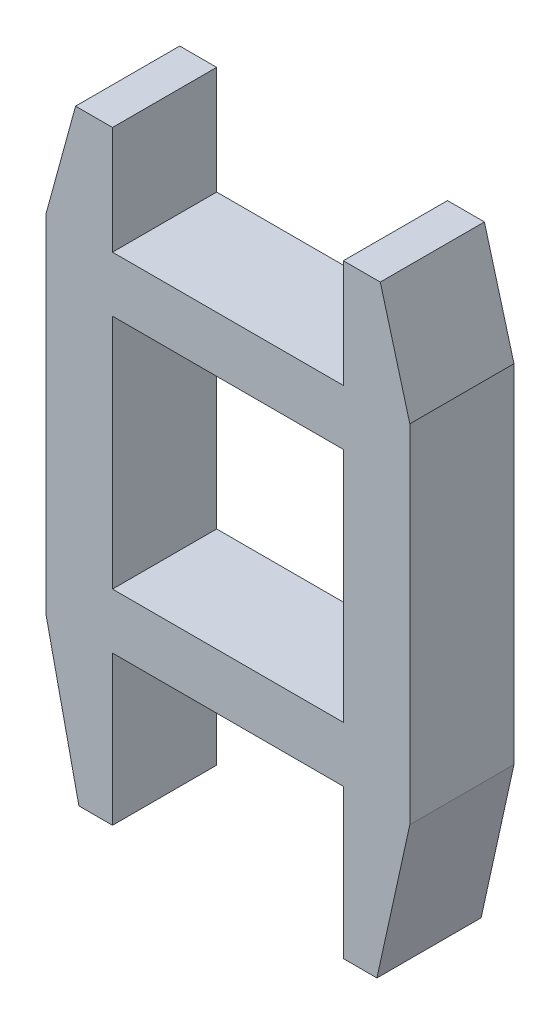
from build123d import *

# Parameters (mm, degrees)
SKETCH1_W           = 12.5
SKETCH1_H           = 12.8
BOSS_EXTRUDE1_DEPTH = 5.64


with BuildPart() as part:
    # Sketch1 → Boss-Extrude1 (new body)
    with BuildSketch(Plane.XY):
        Polygon((1245.159623553, 971.126361431), (1247.159623553, 971.126361431), (1247.159623553, 965.277195661), (1259.659623553, 965.277195661), (1259.659623553, 971.126361431), (1261.659623553, 971.126361431), (1263.259623553, 965.277195661), (1263.259623553, 946.477195661), (1261.478886532, 938.398029891), (1259.659623553, 938.398029891), (1259.659623553, 946.477195661), (1247.159623553, 946.477195661), (1247.159623553, 938.398029891), (1245.340360574, 938.398029891), (1243.559623553, 946.477195661), (1243.559623553, 965.277195661), align=None)
        with Locations((1253.409623553, 955.877195661)):
            Rectangle(SKETCH1_W, SKETCH1_H, mode=Mode.SUBTRACT)
    extrude(amount=BOSS_EXTRUDE1_DEPTH)


solid = part.part
